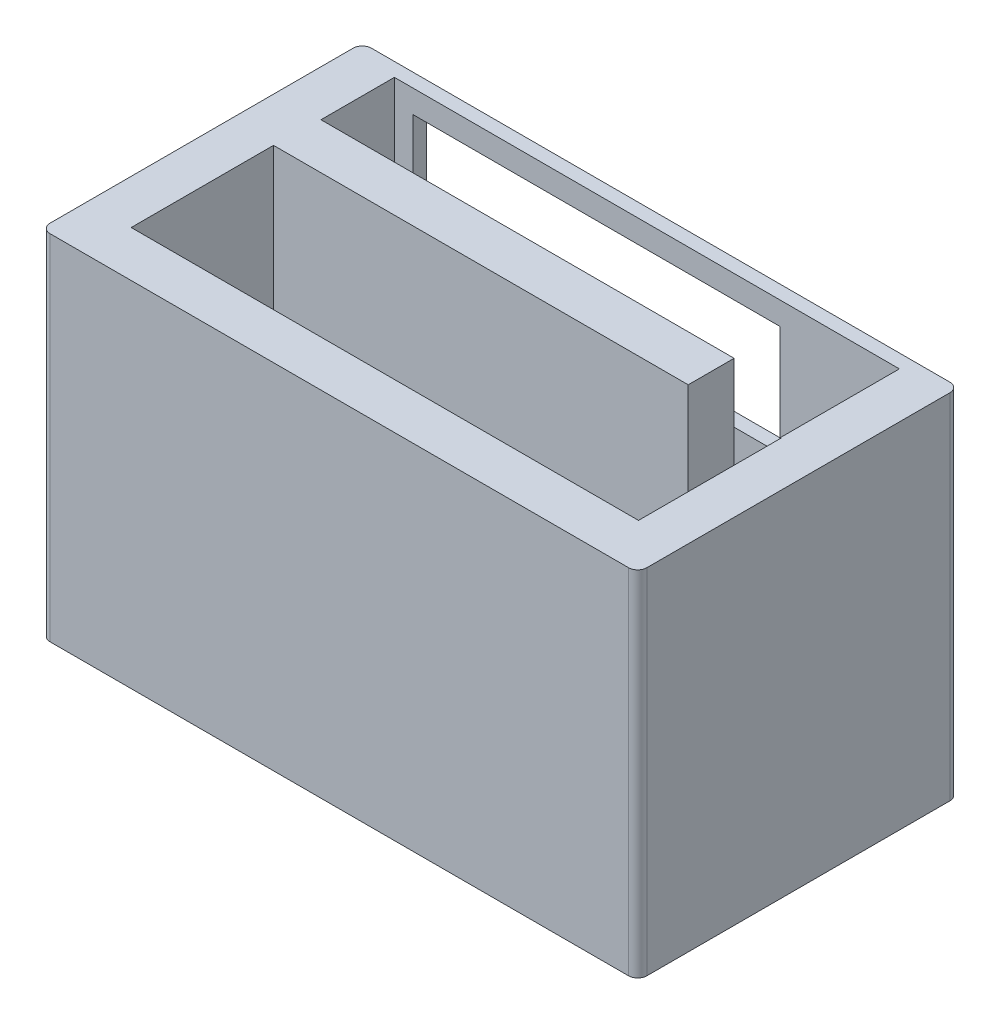
from build123d import *

# Parameters (mm, degrees)
ESQUISSE1_W             = 130
ESQUISSE1_H             = 70
BOSS_EXTRU_1_DEPTH      = 77
ESQUISSE4_W             = 110
ESQUISSE4_H             = 16
ENL_V_MAT_EXTRU_1_DEPTH = 72
ESQUISSE7_W             = 80
ESQUISSE7_H             = 24
ENL_V_MAT_EXTRU_2_DEPTH = 5
ESQUISSE8_W             = 80
ESQUISSE8_H             = 24
ENL_V_MAT_EXTRU_3_DEPTH = 5
CONG_1_R                = 2
ESQUISSE9_W             = 110.509811946
ESQUISSE9_H             = 31
ENL_V_MAT_EXTRU_4_DEPTH = 72
ESQUISSE10_W            = 20
ESQUISSE10_H            = 15.339245472
ENL_V_MAT_EXTRU_5_DEPTH = 72


with BuildPart() as part:
    # Esquisse1 → Boss.-Extru.1 (new body)
    with BuildSketch(Plane(origin=(0, 0, 0), x_dir=(1, 0, 0), z_dir=(0, 1, 0))):
        Rectangle(ESQUISSE1_W, ESQUISSE1_H)
    extrude(amount=BOSS_EXTRU_1_DEPTH)

    # Esquisse4 → Enlèv. mat.-Extru.1 (cut)
    with BuildSketch(Plane(origin=(0, 77, 0), x_dir=(1, 0, 0), z_dir=(0, 1, 0))):
        with Locations((0, 24)):
            Rectangle(ESQUISSE4_W, ESQUISSE4_H)
    extrude(amount=-ENL_V_MAT_EXTRU_1_DEPTH, mode=Mode.SUBTRACT)

    # Esquisse7 → Enlèv. mat.-Extru.2 (cut)
    with BuildSketch(Plane(origin=(0, 0, -35), x_dir=(-1, 0, 0), z_dir=(0, 0, -1))):
        with Locations((11, 23)):
            Rectangle(ESQUISSE7_W, ESQUISSE7_H)
    extrude(amount=-ENL_V_MAT_EXTRU_2_DEPTH, mode=Mode.SUBTRACT)

    # Esquisse8 → Enlèv. mat.-Extru.3 (cut)
    with BuildSketch(Plane(origin=(0, 0, -35), x_dir=(-1, 0, 0), z_dir=(0, 0, -1))):
        with Locations((11, 60)):
            Rectangle(ESQUISSE8_W, ESQUISSE8_H)
    extrude(amount=-ENL_V_MAT_EXTRU_3_DEPTH, mode=Mode.SUBTRACT)

    # Congé1
    cong_1_edges = [part.edges().sort_by_distance(p)[0] for p in [
        (65, 38.5, 35),
        (-65, 38.5, 35),
        (-65, 38.5, -35),
        (65, 38.5, -35),
    ]]
    fillet(cong_1_edges, radius=CONG_1_R)

    # Esquisse9 → Enlèv. mat.-Extru.4 (cut)
    with BuildSketch(Plane(origin=(0, 77, 0), x_dir=(1, 0, 0), z_dir=(0, 1, 0))):
        with Locations((-0.082965324, -9.5)):
            Rectangle(ESQUISSE9_W, ESQUISSE9_H)
    extrude(amount=-ENL_V_MAT_EXTRU_4_DEPTH, mode=Mode.SUBTRACT)

    # Esquisse10 → Enlèv. mat.-Extru.5 (cut)
    with BuildSketch(Plane(origin=(0, 77, 0), x_dir=(1, 0, 0), z_dir=(0, 1, 0))):
        with Locations((45, 11.431206797)):
            Rectangle(ESQUISSE10_W, ESQUISSE10_H)
    extrude(amount=-ENL_V_MAT_EXTRU_5_DEPTH, mode=Mode.SUBTRACT)


solid = part.part
